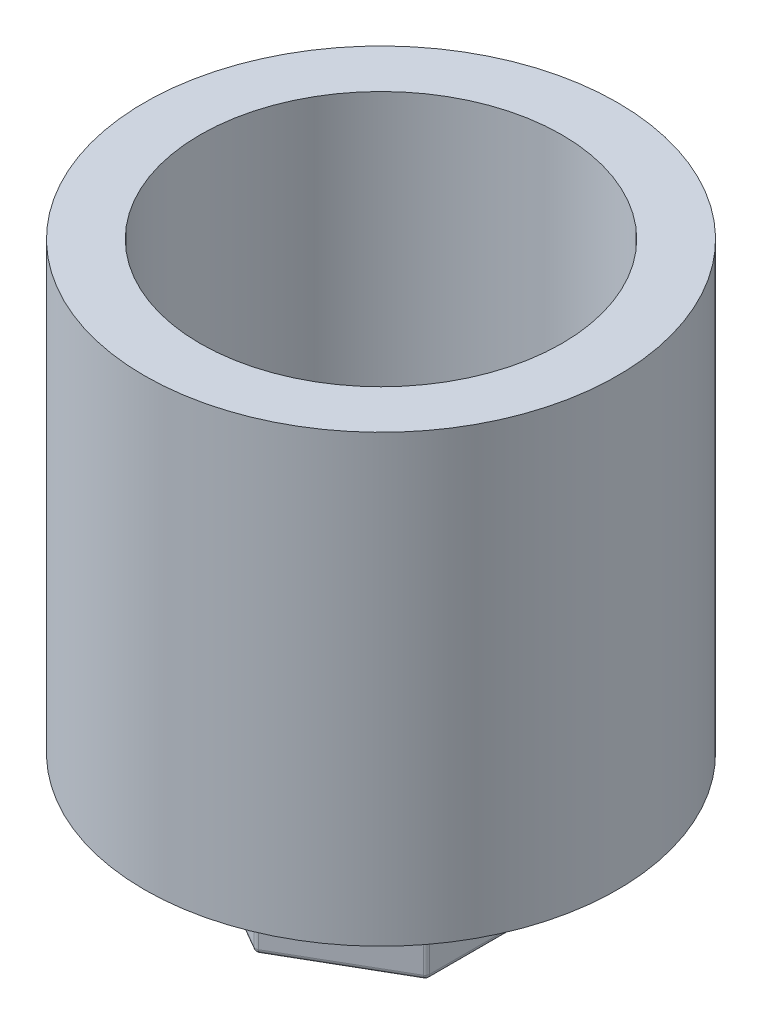
from build123d import *

# Parameters (mm, degrees)
SKETCH1_R                   = 13.5
BOSS_EXTRUDE1_DEPTH         = 25.4
F_7_8_14_TAPPED_HOLE1_D     = 20.6375
F_7_8_14_TAPPED_HOLE1_DEPTH = 19.05
F_7_8_14_TAPPED_HOLE1_TIP   = 6.200130513
BOSS_EXTRUDE2_DEPTH         = 6.35
FILLET1_R                   = 0.254


with BuildPart() as part:
    # Sketch1 → Boss-Extrude1 (new body)
    with BuildSketch(Plane(origin=(0, 0, 0), x_dir=(1, 0, 0), z_dir=(0, 1, 0))):
        Circle(SKETCH1_R)
    extrude(amount=BOSS_EXTRUDE1_DEPTH)

    # 7/8-14 Tapped Hole1
    with Locations(Plane(origin=(0, 25.4, 0), x_dir=(1, 0, 0), z_dir=(0, 1, 0))):
        with Locations((0, 0)):
            Hole(F_7_8_14_TAPPED_HOLE1_D / 2, depth=F_7_8_14_TAPPED_HOLE1_DEPTH)
            with Locations((0, 0, -(F_7_8_14_TAPPED_HOLE1_DEPTH + F_7_8_14_TAPPED_HOLE1_TIP / 2))):  # 118° drill point
                Cone(0, F_7_8_14_TAPPED_HOLE1_D / 2, F_7_8_14_TAPPED_HOLE1_TIP, mode=Mode.SUBTRACT)

    # Sketch6 → Boss-Extrude2 (add)
    with BuildSketch(Plane.XZ):
        Polygon((6.223, 3.592850725), (0, 7.18570145), (-6.223, 3.592850725), (-6.223, -3.592850725), (0, -7.18570145), (6.223, -3.592850725), align=None)
    extrude(amount=BOSS_EXTRUDE2_DEPTH)

    # Fillet1
    fillet1_edges = [part.edges().sort_by_distance(p)[0] for p in [
        (3.1115, 0, -5.389276088),
        (-6.223, 0, 0),
        (-6.223, -3.175, -3.592850725),
        (0, -3.175, -7.18570145),
        (-3.1115, 0, -5.389276088),
        (6.223, -3.175, -3.592850725),
        (6.223, 0, 0),
        (-6.223, -3.175, 3.592850725),
        (-3.1115, 0, 5.389276088),
        (6.223, -3.175, 3.592850725),
        (0, -3.175, 7.18570145),
        (3.1115, 0, 5.389276088),
        (3.1115, -6.35, -5.389276088),
        (-3.1115, -6.35, -5.389276088),
        (-6.223, -6.35, 0),
        (-3.1115, -6.35, 5.389276088),
        (3.1115, -6.35, 5.389276088),
        (6.223, -6.35, 0),
    ]]
    fillet(fillet1_edges, radius=FILLET1_R)


solid = part.part
